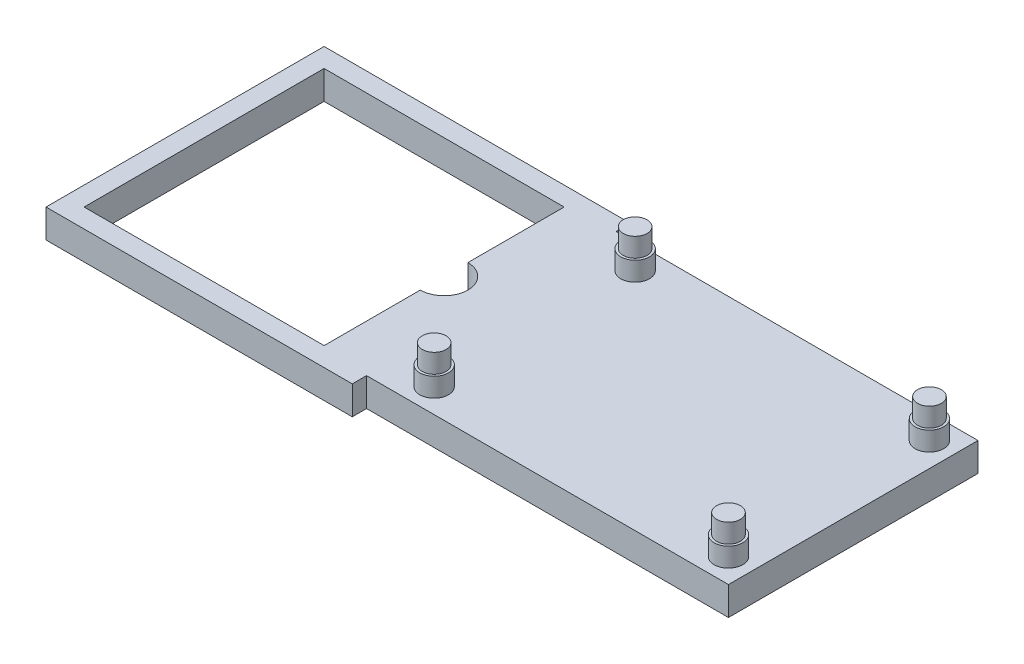
from build123d import *

# Parameters (mm, degrees)
SKETCH1_W            = 36
SKETCH1_H            = 26.2
SKETCH1_R            = 1.5
BOSS_EXTRUDE1_DEPTH  = 3
SKETCH1_3_R          = 1.5
BOSS_EXTRUDE2_DEPTH  = 5
SKETCH2_R            = 1.25
BOSS_EXTRUDE3_DEPTH  = 2
SKETCH3_R            = 1.25
BOSS_EXTRUDE4_DEPTH  = 2
SKETCH4_R            = 1.25
BOSS_EXTRUDE5_DEPTH  = 2
SKETCH5_R            = 1.25
BOSS_EXTRUDE6_DEPTH  = 2
SKETCH1_4_W          = 2
SKETCH1_4_H          = 26.2
BOSS_EXTRUDE7_DEPTH  = 3
SKETCH1_5_W          = 32.156996587
SKETCH1_5_H          = 26.2
BOSS_EXTRUDE8_DEPTH  = 3
SKETCH6_W            = 32.156996587
SKETCH6_H            = 3
BOSS_EXTRUDE9_DEPTH  = 1.5
SKETCH7_W            = 32.156996587
SKETCH7_H            = 3
BOSS_EXTRUDE10_DEPTH = 1.5
SKETCH8_W            = 25.2
SKETCH8_H            = 25.2
CUT_EXTRUDE1_DEPTH   = 59.252119408
SKETCH9_R            = 2.5
CUT_EXTRUDE2_DEPTH   = 59.252119408


with BuildPart() as part:
    # Sketch1 → Boss-Extrude1 (new body)
    with BuildSketch(Plane(origin=(0, 0, 0), x_dir=(1, 0, 0), z_dir=(0, 1, 0))):
        with Locations((0.675767918, -12.362798635)):
            Rectangle(SKETCH1_W, SKETCH1_H)
        with Locations((-14.774232082, -22.912798635)):
            Circle(SKETCH1_R, mode=Mode.SUBTRACT)
        with Locations((16.125767918, -22.912798635)):
            Circle(SKETCH1_R, mode=Mode.SUBTRACT)
        with Locations((-14.774232082, -1.812798635)):
            Circle(SKETCH1_R, mode=Mode.SUBTRACT)
        with Locations((16.125767918, -1.812798635)):
            Circle(SKETCH1_R, mode=Mode.SUBTRACT)
    extrude(amount=BOSS_EXTRUDE1_DEPTH)

    # Sketch1<3> → Boss-Extrude2 (add)
    with BuildSketch(Plane(origin=(0, 0, 0), x_dir=(1, 0, 0), z_dir=(0, 1, 0))):
        with Locations((-14.774232082, -1.812798635)):
            Circle(SKETCH1_3_R)
        with Locations((16.125767918, -1.812798635)):
            Circle(SKETCH1_3_R)
        with Locations((-14.774232082, -22.912798635)):
            Circle(SKETCH1_3_R)
        with Locations((16.125767918, -22.912798635)):
            Circle(SKETCH1_3_R)
    extrude(amount=BOSS_EXTRUDE2_DEPTH)

    # Sketch2 → Boss-Extrude3 (add)
    with BuildSketch(Plane(origin=(0, 5, 0), x_dir=(1, 0, 0), z_dir=(0, 1, 0))):
        with Locations((-14.774232082, -1.812798635)):
            Circle(SKETCH2_R)
    extrude(amount=BOSS_EXTRUDE3_DEPTH)

    # Sketch3 → Boss-Extrude4 (add)
    with BuildSketch(Plane(origin=(0, 5, 0), x_dir=(1, 0, 0), z_dir=(0, 1, 0))):
        with Locations((16.125767918, -1.812798635)):
            Circle(SKETCH3_R)
    extrude(amount=BOSS_EXTRUDE4_DEPTH)

    # Sketch4 → Boss-Extrude5 (add)
    with BuildSketch(Plane(origin=(0, 5, 0), x_dir=(1, 0, 0), z_dir=(0, 1, 0))):
        with Locations((16.125767918, -22.912798635)):
            Circle(SKETCH4_R)
    extrude(amount=BOSS_EXTRUDE5_DEPTH)

    # Sketch5 → Boss-Extrude6 (add)
    with BuildSketch(Plane(origin=(0, 5, 0), x_dir=(1, 0, 0), z_dir=(0, 1, 0))):
        with Locations((-14.774232082, -22.912798635)):
            Circle(SKETCH5_R)
    extrude(amount=BOSS_EXTRUDE6_DEPTH)

    # Sketch1<4> → Boss-Extrude7 (add)
    with BuildSketch(Plane(origin=(0, 0, 0), x_dir=(1, 0, 0), z_dir=(0, 1, 0))):
        with Locations((-18.324232082, -12.362798635)):
            Rectangle(SKETCH1_4_W, SKETCH1_4_H)
    extrude(amount=BOSS_EXTRUDE7_DEPTH)

    # Sketch1<5> → Boss-Extrude8 (add)
    with BuildSketch(Plane(origin=(0, 0, 0), x_dir=(1, 0, 0), z_dir=(0, 1, 0))):
        with Locations((-35.402730375, -12.362798635)):
            Rectangle(SKETCH1_5_W, SKETCH1_5_H)
    extrude(amount=BOSS_EXTRUDE8_DEPTH)

    # Sketch6 → Boss-Extrude9 (add)
    with BuildSketch(Plane.XY.offset(25.462798635)):
        with Locations((-35.402730375, 1.5)):
            Rectangle(SKETCH6_W, SKETCH6_H)
    extrude(amount=BOSS_EXTRUDE9_DEPTH)

    # Sketch7 → Boss-Extrude10 (add)
    with BuildSketch(Plane(origin=(0, 0, -0.737201365), x_dir=(-1, 0, 0), z_dir=(0, 0, -1))):
        with Locations((35.402730375, 1.5)):
            Rectangle(SKETCH7_W, SKETCH7_H)
    extrude(amount=BOSS_EXTRUDE10_DEPTH)

    # Sketch8 → Cut-Extrude1 (cut, through all)
    with BuildSketch(Plane(origin=(0, 3, 0), x_dir=(1, 0, 0), z_dir=(0, 1, 0))):
        with Locations((-36.881228669, -12.362798635)):
            Rectangle(SKETCH8_W, SKETCH8_H)
    extrude(amount=-CUT_EXTRUDE1_DEPTH, mode=Mode.SUBTRACT)

    # Sketch9 → Cut-Extrude2 (cut, through all)
    with BuildSketch(Plane(origin=(0, 3, 0), x_dir=(1, 0, 0), z_dir=(0, 1, 0))):
        with Locations((-24.281228669, -12.362798635)):
            Circle(SKETCH9_R)
    extrude(amount=-CUT_EXTRUDE2_DEPTH, mode=Mode.SUBTRACT)


solid = part.part
